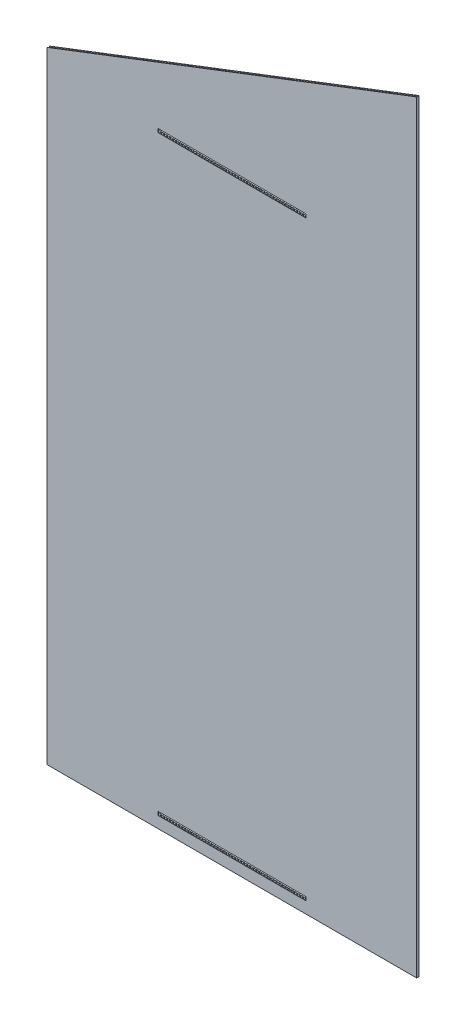
from build123d import *

# Parameters (mm, degrees)
BOSS_EXTRUDE1_DEPTH = 2580.7
LPATTERN1_COUNT     = 125
LPATTERN1_PITCH     = 10
SKETCH2_W           = 500.2
SKETCH2_H           = 12.1
CUT_EXTRUDE1_DEPTH  = 2866.327466451
LPATTERN2_COUNT     = 2
LPATTERN2_PITCH     = 2000


with BuildPart() as part:
    # Sketch1 → Boss-Extrude1 (new body)
    with BuildSketch(Plane(origin=(0, 0, 0), x_dir=(1, 0, 0), z_dir=(0, 1, 0))):
        Polygon((5, -4), (-5.3, -4), (-5.3, -3.7), (4.7, -3.7), (4.7, 3.7), (-5.3, 3.7), (-5.3, 4), (5, 4), align=None)
    boss_extrude1 = extrude(amount=BOSS_EXTRUDE1_DEPTH)

    # LPattern1: Boss-Extrude1 ×125
    with Locations(*[(i * LPATTERN1_PITCH, 0, 0) for i in range(1, LPATTERN1_COUNT)]):
        add(boss_extrude1)

    # Sketch2 → Cut-Extrude1 (cut, through all)
    with BuildSketch(Plane.XY.offset(4)):
        with Locations((619.85, 44.95)):
            Rectangle(SKETCH2_W, SKETCH2_H)
        Polygon((1245, 2580.7), (-5.3, 2100.754796995), (-5.3, 2580.7), align=None)
    cut_extrude1 = extrude(amount=-CUT_EXTRUDE1_DEPTH, mode=Mode.SUBTRACT)

    # LPattern2: Cut-Extrude1 ×2
    with Locations(*[(0, i * LPATTERN2_PITCH, 0) for i in range(1, LPATTERN2_COUNT)]):
        add(cut_extrude1, mode=Mode.SUBTRACT)


solid = part.part
